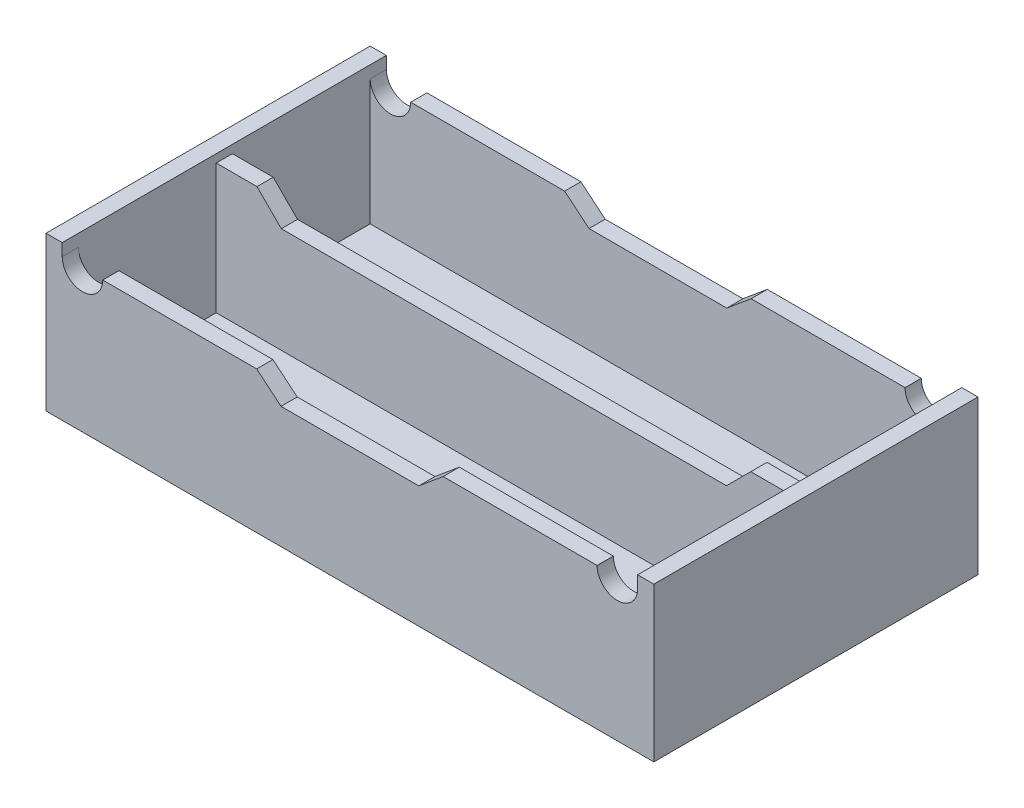
from build123d import *

# Parameters (mm, degrees)
SKETCH1_W           = 75
SKETCH1_H           = 40
BOSS_EXTRUDE1_DEPTH = 2
SKETCH2_W           = 75
SKETCH2_H           = 40
SKETCH2_W_2         = 71
SKETCH2_H_2         = 17
BOSS_EXTRUDE2_DEPTH = 17
CUT_EXTRUDE2_DEPTH  = 17
CUT_EXTRUDE3_REACH  = 82.169
CUT_EXTRUDE4_REACH  = 88.683
SKETCH5_R           = 1.6


with BuildPart() as part:
    # Sketch1 → Boss-Extrude1 (new body)
    with BuildSketch(Plane(origin=(0, 0, 0), x_dir=(1, 0, 0), z_dir=(0, 1, 0))):
        with Locations((37.5, 20)):
            Rectangle(SKETCH1_W, SKETCH1_H)
    extrude(amount=BOSS_EXTRUDE1_DEPTH)

    # Sketch2 → Boss-Extrude2 (add)
    with BuildSketch(Plane(origin=(0, 2, 0), x_dir=(1, 0, 0), z_dir=(0, 1, 0))):
        with Locations((37.5, 20)):
            Rectangle(SKETCH2_W, SKETCH2_H)
        with Locations((37.5, 29.5)):
            Rectangle(SKETCH2_W_2, SKETCH2_H_2, mode=Mode.SUBTRACT)
        with Locations((37.5, 10.5)):
            Rectangle(SKETCH2_W_2, SKETCH2_H_2, mode=Mode.SUBTRACT)
    extrude(amount=BOSS_EXTRUDE2_DEPTH)

    # Sketch3 → Cut-Extrude2 (cut)
    with BuildSketch(Plane.XY):
        with BuildLine():
            Line((2, 17.5), (2, 19))
            Line((2, 19), (73, 19))
            Line((73, 19), (73, 17.5))
            ThreePointArc((73, 17.5), (70.5, 15), (68, 17.5))
            Line((68, 17.5), (49, 17.5))
            Line((49, 17.5), (46, 15))
            Line((46, 15), (29, 15))
            Line((29, 15), (26, 17.5))
            Line((26, 17.5), (7, 17.5))
            ThreePointArc((7, 17.5), (4.5, 15), (2, 17.5))
        make_face()
    cut_extrude2 = extrude(amount=-CUT_EXTRUDE2_DEPTH, mode=Mode.SUBTRACT)

    # Mirror1: Cut-Extrude2 across plane
    add(cut_extrude2.mirror(Plane.XY.offset(-20)), mode=Mode.SUBTRACT)

    # Sketch4 → Cut-Extrude3 (cut, up to next)
    with BuildSketch(Plane.XY.offset(-19), mode=Mode.PRIVATE) as cut_extrude3_sk1:
        Polygon((2, 18), (7.035918341, 18), (10.035918341, 15), (64.964081659, 15), (67.964081659, 18), (73, 18), (73, 19), (2, 19), align=None)
    cut_extrude3_tool1 = extrude(cut_extrude3_sk1.sketch, amount=-CUT_EXTRUDE3_REACH, mode=Mode.PRIVATE) & part.part
    add(cut_extrude3_tool1.solids().sort_by_distance((37.5, 17.098486, -19))[0], mode=Mode.SUBTRACT)

    # Sketch5 → Cut-Extrude4 (cut, up to next)
    with BuildSketch(Plane(origin=(0, 2, 0), x_dir=(1, 0, 0), z_dir=(0, 1, 0)), mode=Mode.PRIVATE) as cut_extrude4_sk1:
        with Locations((37.5, 29.5)):
            Circle(SKETCH5_R)
    cut_extrude4_tool1 = extrude(cut_extrude4_sk1.sketch, amount=-CUT_EXTRUDE4_REACH, mode=Mode.PRIVATE) & part.part
    # Sketch5 → Cut-Extrude4 (cut, up to next)
    with BuildSketch(Plane(origin=(0, 2, 0), x_dir=(1, 0, 0), z_dir=(0, 1, 0)), mode=Mode.PRIVATE) as cut_extrude4_sk2:
        with Locations((37.5, 10.5)):
            Circle(SKETCH5_R)
    cut_extrude4_tool2 = extrude(cut_extrude4_sk2.sketch, amount=-CUT_EXTRUDE4_REACH, mode=Mode.PRIVATE) & part.part
    add(cut_extrude4_tool1.solids().sort_by_distance((37.5, 2, -29.5))[0], mode=Mode.SUBTRACT)
    add(cut_extrude4_tool2.solids().sort_by_distance((37.5, 2, -10.5))[0], mode=Mode.SUBTRACT)


solid = part.part
